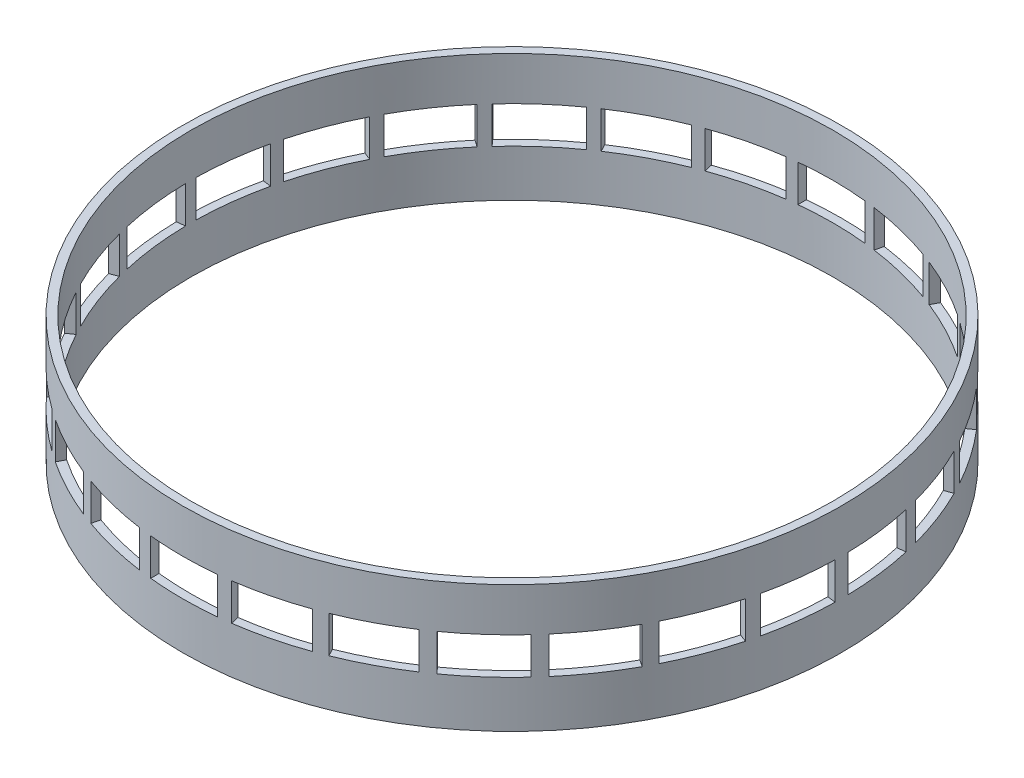
from build123d import *

# Parameters (mm, degrees)
SKETCH1_R           = 98.5
SKETCH1_R_2         = 96
BOSS_EXTRUDE1_DEPTH = 38
SKETCH2_W           = 20
SKETCH2_H           = 11
CUT_EXTRUDE1_DEPTH  = 145.390096613
CIRPATTERN1_COUNT   = 13


with BuildPart() as part:
    # Sketch1 → Boss-Extrude1 (new body)
    with BuildSketch(Plane(origin=(0, 0, 0), x_dir=(1, 0, 0), z_dir=(0, 1, 0))):
        Circle(SKETCH1_R)
        Circle(SKETCH1_R_2, mode=Mode.SUBTRACT)
    extrude(amount=BOSS_EXTRUDE1_DEPTH)

    # Sketch2 → Cut-Extrude1 (cut, symmetric)
    with BuildSketch(Plane.XY):
        with Locations((0, 19.5)):
            Rectangle(SKETCH2_W, SKETCH2_H)
    cut_extrude1 = extrude(amount=CUT_EXTRUDE1_DEPTH, both=True, mode=Mode.SUBTRACT)

    # CirPattern1: Cut-Extrude1 ×13 about axis
    cirpattern1_axis = Axis((0, 0, 0), (0, 1, 0))
    for i in range(1, CIRPATTERN1_COUNT):
        add(cut_extrude1.rotate(cirpattern1_axis, i * 360 / CIRPATTERN1_COUNT), mode=Mode.SUBTRACT)


solid = part.part
